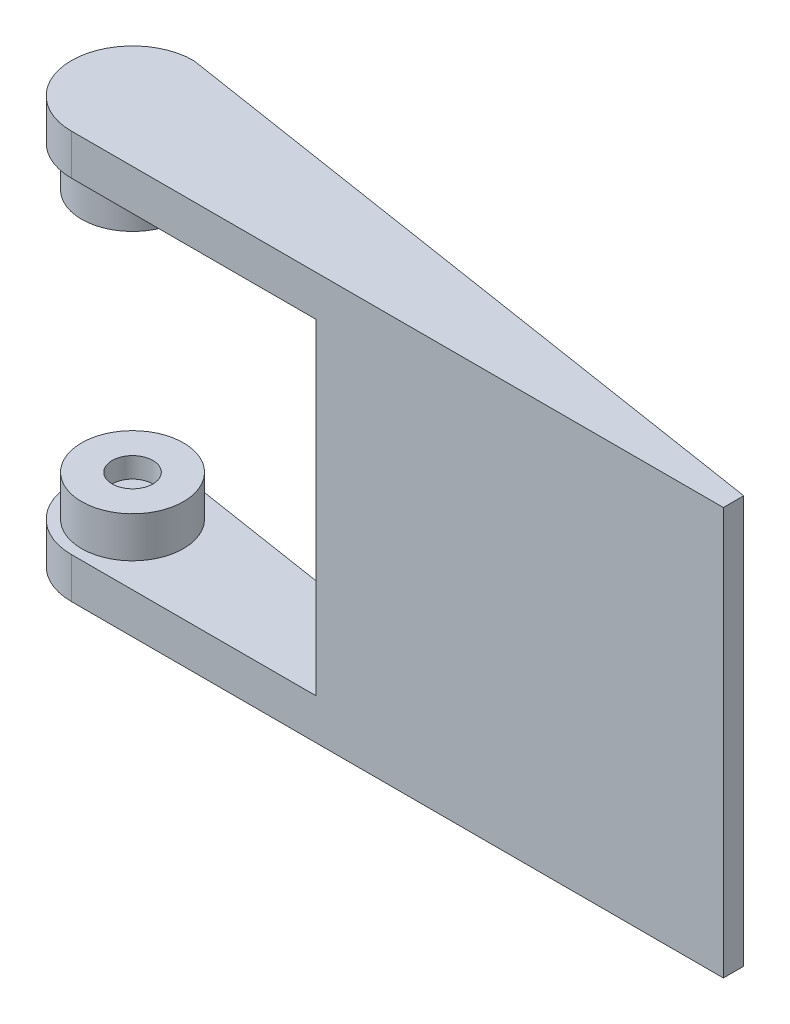
from build123d import *

# Parameters (mm, degrees)
BOSS_EXTRUDE1_DEPTH = 50
CUT_EXTRUDE1_START  = -40
SKETCH2_R           = 12.5
CUT_EXTRUDE1_DEPTH  = 40
CUT_EXTRUDE2_START  = -30
SKETCH3_R           = 12.5
CUT_EXTRUDE2_DEPTH  = 30
SKETCH4_R           = 5
CUT_EXTRUDE3_DEPTH  = 5


with BuildPart() as part:
    # Sketch1 → Boss-Extrude1 (new body)
    with BuildSketch(Plane(origin=(0, 0, 0), x_dir=(1, 0, 0), z_dir=(0, 1, 0))):
        with BuildLine():
            ThreePointArc((0, 15), (-15, 0), (0, -15))
            Line((0, -15), (160, -15))
            Line((160, -15), (160, -10))
            Line((160, -10), (0, 15))
        make_face()
    boss_extrude1 = extrude(amount=BOSS_EXTRUDE1_DEPTH)

    # Sketch2 → Cut-Extrude1 (cut)
    with BuildSketch(Plane(origin=(0, 50, 0), x_dir=(1, 0, 0), z_dir=(0, 1, 0)).offset(CUT_EXTRUDE1_START)):
        with BuildLine():
            Line((60, 5.625), (0, 15))
            ThreePointArc((0, 15), (-15, 0), (0, -15))
            Line((0, -15), (60, -15))
            Line((60, -15), (60, 5.625))
        make_face()
        Circle(SKETCH2_R, mode=Mode.SUBTRACT)
    cut_extrude1 = extrude(amount=CUT_EXTRUDE1_DEPTH, mode=Mode.SUBTRACT)

    # Sketch3 → Cut-Extrude2 (cut)
    with BuildSketch(Plane(origin=(0, 50, 0), x_dir=(1, 0, 0), z_dir=(0, 1, 0)).offset(CUT_EXTRUDE2_START)):
        Circle(SKETCH3_R)
    cut_extrude2 = extrude(amount=CUT_EXTRUDE2_DEPTH, mode=Mode.SUBTRACT)

    # Sketch4 → Cut-Extrude3 (cut)
    with BuildSketch(Plane(origin=(0, 20, 0), x_dir=(1, 0, 0), z_dir=(0, 1, 0))):
        Circle(SKETCH4_R)
    cut_extrude3 = extrude(amount=-CUT_EXTRUDE3_DEPTH, mode=Mode.SUBTRACT)

    # Mirror1: Boss-Extrude1, Cut-Extrude1, Cut-Extrude2, Cut-Extrude3 across plane
    add(boss_extrude1.mirror(Plane.ZX.offset(50)))
    add(cut_extrude1.mirror(Plane.ZX.offset(50)), mode=Mode.SUBTRACT)
    add(cut_extrude2.mirror(Plane.ZX.offset(50)), mode=Mode.SUBTRACT)
    add(cut_extrude3.mirror(Plane.ZX.offset(50)), mode=Mode.SUBTRACT)


solid = part.part
